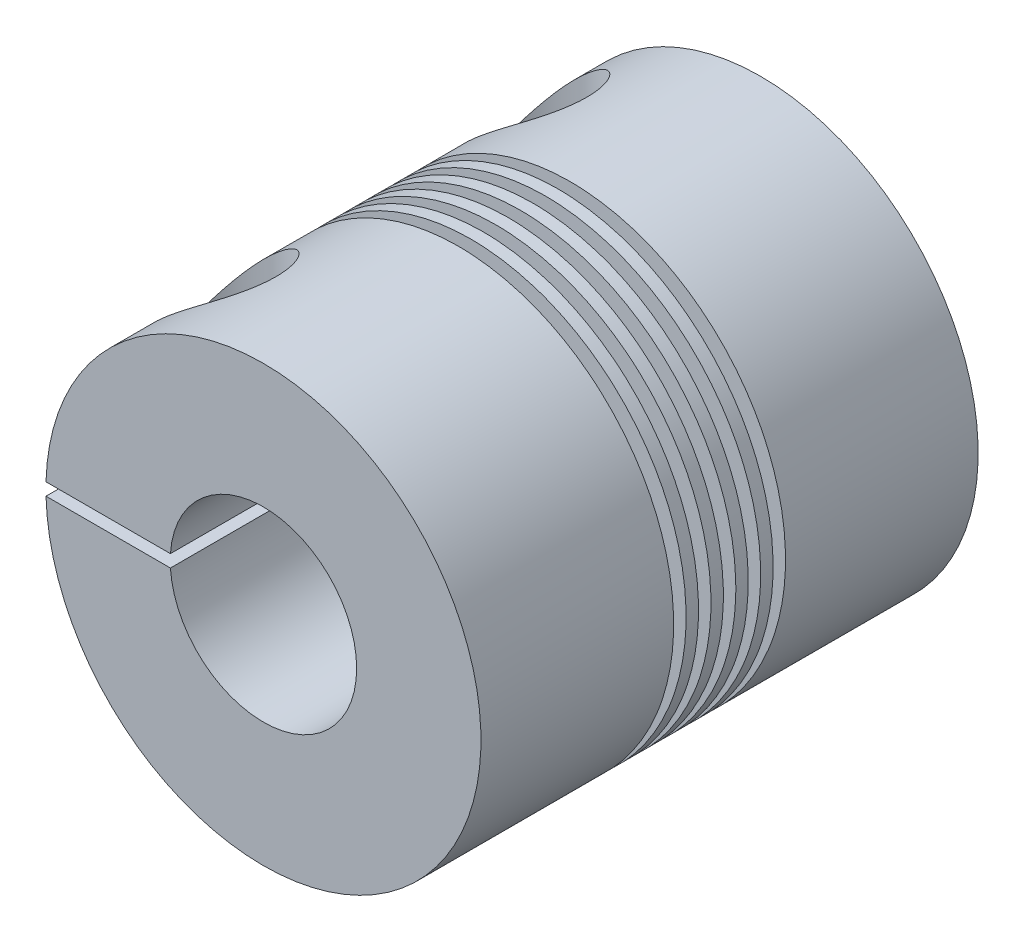
from build123d import *

# Parameters (mm, degrees)
CROQUIS1_R                                  = 17.5
SALIENTE_EXTRUIR1_DEPTH                     = 40
CORTAR_BARRER2_PITCH                        = 2
CROQUIS8_R                                  = 7.5
CORTAR_EXTRUIR1_DEPTH                       = 15
CROQUIS9_R                                  = 5
CORTAR_EXTRUIR2_DEPTH                       = 15
CROQUIS13_W                                 = 13
CROQUIS13_H                                 = 1
CORTAR_EXTRUIR3_DEPTH                       = 28
REFRENTADO_PARA_TORNILLO_CON_CABEZA_2_COUNT = 2
REFRENTADO_PARA_TORNILLO_CON_CABEZA_2_PITCH = 25


with BuildPart() as part:
    # Croquis1 → Saliente-Extruir1 (new body)
    with BuildSketch(Plane.XY):
        Circle(CROQUIS1_R)
    extrude(amount=SALIENTE_EXTRUIR1_DEPTH)

    # Cortar-Barrer2: the profile of Croquis7 profile screwed along a left-hand helix of 5 turns, 10 arcs to a turn; built about Z, then put on its axis
    cortar_barrer2_z = Axis((0, 0, 0), (0, 0, 1))
    cortar_barrer2_corners = [(17.5003, 0, -0.5), (17.5003, 0, 0.5), (9.5, 0, 0.5), (9.5, 0, -0.5)]
    with BuildLine(mode=Mode.PRIVATE) as cortar_barrer2_profile:
        Line(cortar_barrer2_corners[0], cortar_barrer2_corners[1])
        Line(cortar_barrer2_corners[1], cortar_barrer2_corners[2])
        Line(cortar_barrer2_corners[2], cortar_barrer2_corners[3])
        Line(cortar_barrer2_corners[3], cortar_barrer2_corners[0])
    cortar_barrer2_cap = Face(cortar_barrer2_profile.wire())
    cortar_barrer2_turn_angles = [0, -18, -36, -54, -72, -90, -108, -126, -144, -162, -180, -198, -216, -234, -252, -270, -288, -306, -324, -342, -360]
    cortar_barrer2_turn_weights = [1, 0.9510565162951535, 1, 0.9510565162951535, 1, 0.9510565162951535, 1, 0.9510565162951535, 1, 0.9510565162951535, 1, 0.9510565162951535, 1, 0.9510565162951535, 1, 0.9510565162951535, 1, 0.9510565162951535, 1, 0.9510565162951535, 1]
    cortar_barrer2_turn_rails = [Edge.make_bspline([Vector(p[0], p[1], 0).rotate(cortar_barrer2_z, cortar_barrer2_turn_angles[k]) / cortar_barrer2_turn_weights[k] + Vector(0, 0, p[2] + -CORTAR_BARRER2_PITCH * cortar_barrer2_turn_angles[k] / 360) for k in range(21)], [0, 0, 0, 1, 1, 2, 2, 3, 3, 4, 4, 5, 5, 6, 6, 7, 7, 8, 8, 9, 9, 10, 10, 10], 2, cortar_barrer2_turn_weights) for p in cortar_barrer2_corners]
    cortar_barrer2_turn_sides = [Face.make_surface_from_curves(cortar_barrer2_turn_rails[p[0]], cortar_barrer2_turn_rails[p[1]]) for p in [(0, 1), (1, 2), (2, 3), (3, 0)]]
    cortar_barrer2 = Plane(origin=(0, 0, 15), x_dir=(-1, 0, 0), z_dir=(0, 0, 1)) * Solid(Shell([*[p.moved(Location((0, 0, CORTAR_BARRER2_PITCH * i))) for i in range(5) for p in cortar_barrer2_turn_sides], cortar_barrer2_cap, cortar_barrer2_cap.rotate(cortar_barrer2_z, -1800).moved(Location((0, 0, -CORTAR_BARRER2_PITCH * -1800 / 360)))]))
    add(cortar_barrer2, mode=Mode.SUBTRACT)

    # Croquis8 → Cortar-Extruir1 (cut)
    with BuildSketch(Plane.XY.offset(40)):
        Circle(CROQUIS8_R)
    extrude(amount=-CORTAR_EXTRUIR1_DEPTH, mode=Mode.SUBTRACT)

    # Croquis9 → Cortar-Extruir2 (cut)
    with BuildSketch(Plane(origin=(0, 0, 0), x_dir=(-1, 0, 0), z_dir=(0, 0, -1))):
        Circle(CROQUIS9_R)
    extrude(amount=-CORTAR_EXTRUIR2_DEPTH, mode=Mode.SUBTRACT)

    # Croquis13 → Cortar-Extruir3 (cut)
    with BuildSketch(Plane(origin=(0, 0, 0), x_dir=(0, 0, -1), z_dir=(1, 0, 0))):
        with Locations((-6.5, 0)):
            Rectangle(CROQUIS13_W, CROQUIS13_H)
        with Locations((-33.5, 0)):
            Rectangle(CROQUIS13_W, CROQUIS13_H)
    extrude(amount=-CORTAR_EXTRUIR3_DEPTH, mode=Mode.SUBTRACT)

    # Croquis23 → Refrentado para tornillo con cabeza troncocónica de M42 (revolve, cut)
    with BuildSketch(Plane(origin=(-11.492855685, 17.5, 32), x_dir=(0, 0, 1), z_dir=(1, 0, 0))):
        Polygon((0, 0), (0, 35.900588924), (2.25, 35.900588924), (2.25, 11), (4.5, 11), (4.5, 0.025), (4.525, 0), align=None)
    refrentado_para_tornillo_con_cabeza_tron = revolve(axis=Axis((-11.492855685, 23.85, 32), (0, -1, 0)), mode=Mode.SUBTRACT)

    # Refrentado para tornillo con cabeza  2: Refrentado para tornillo con cabeza troncocónica de M42 ×2
    with Locations(*[(0, 0, -i * REFRENTADO_PARA_TORNILLO_CON_CABEZA_2_PITCH) for i in range(1, REFRENTADO_PARA_TORNILLO_CON_CABEZA_2_COUNT)]):
        add(refrentado_para_tornillo_con_cabeza_tron, mode=Mode.SUBTRACT)


solid = part.part
